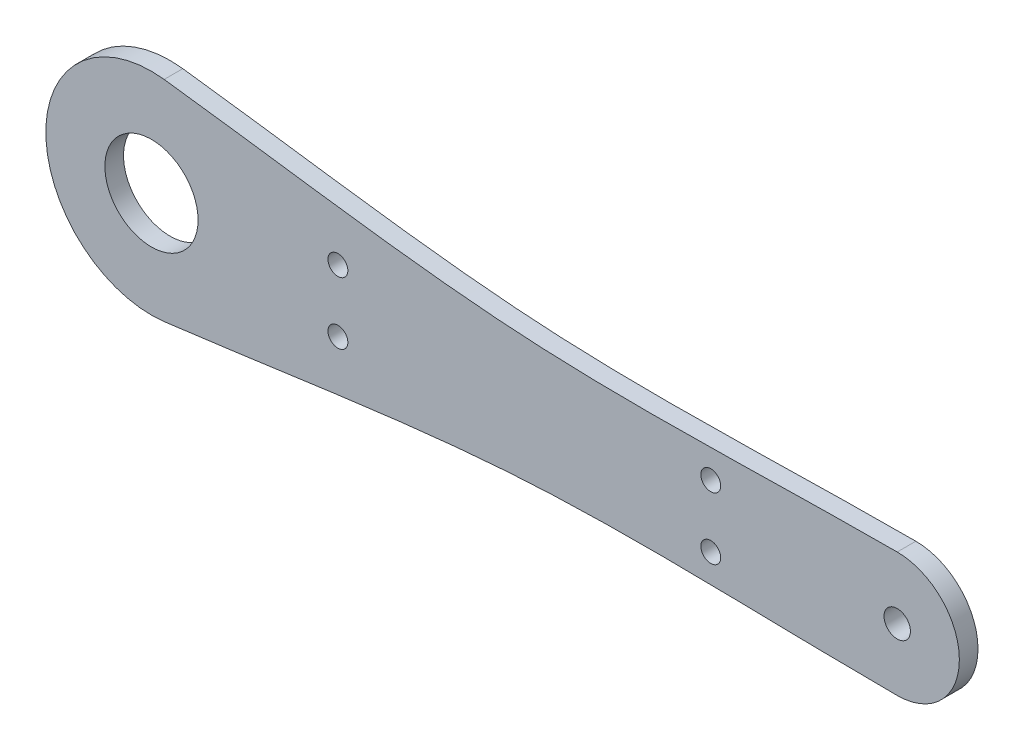
from build123d import *

# Parameters (mm, degrees)
SKETCH1_R           = 7.5
SKETCH1_R_2         = 2.125
SKETCH1_R_3         = 1.6
BOSS_EXTRUDE1_DEPTH = 3


with BuildPart() as part:
    # Sketch1 → Boss-Extrude1 (new body)
    with BuildSketch(Plane.XY):
        with BuildLine():
            ThreePointArc((-57.956829007, 16.876772567), (-77, 0), (-57.956829007, -16.876772567))
            add(Edge.make_bspline(
                [(60, -10), (39.938279517, -10), (0.415985338, -7.693613776), (-38.598478023, -14.486949791), (-57.956829007, -16.876772567)],
                knots=[0, 0, 0, 0, 0.506913544, 1, 1, 1, 1], degree=3))
            ThreePointArc((60, -10), (70, 0), (60, 10))
            add(Edge.make_bspline(
                [(60, 10), (39.938279517, 10), (0.415985338, 7.693613776), (-38.598478023, 14.486949791), (-57.956829007, 16.876772567)],
                knots=[0, 0, 0, 0, 0.506913544, 1, 1, 1, 1], degree=3))
        make_face()
        with Locations((-60, 0)):
            Circle(SKETCH1_R, mode=Mode.SUBTRACT)
        with Locations((60, 0)):
            Circle(SKETCH1_R_2, mode=Mode.SUBTRACT)
        with Locations((-30, 5)):
            Circle(SKETCH1_R_3, mode=Mode.SUBTRACT)
        with Locations((30, 5)):
            Circle(SKETCH1_R_3, mode=Mode.SUBTRACT)
        with Locations((30, -5)):
            Circle(SKETCH1_R_3, mode=Mode.SUBTRACT)
        with Locations((-30, -5)):
            Circle(SKETCH1_R_3, mode=Mode.SUBTRACT)
    extrude(amount=BOSS_EXTRUDE1_DEPTH)


solid = part.part
